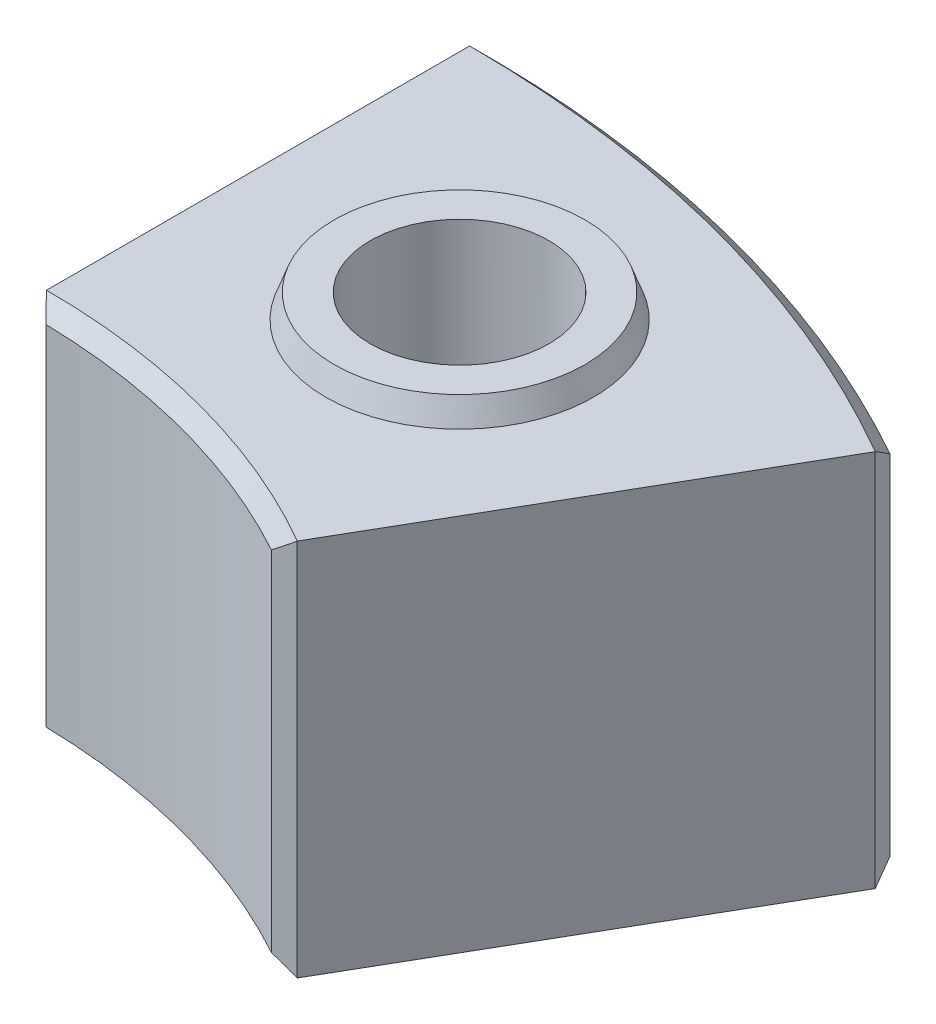
from build123d import *

# Parameters (mm, degrees)
SKETCH1_R           = 30
BOSS_EXTRUDE1_DEPTH = 127
BOSS_EXTRUDE2_START = 8
SKETCH3_R           = 45
SKETCH3_R_2         = 30
BOSS_EXTRUDE2_DEPTH = 8
CHAMFER1_SIZE2      = 8
CHAMFER1_SIZE       = 2.911761874
CUT_EXTRUDE1_START  = -10
SKETCH4_R           = 46
SKETCH4_R_2         = 30
CUT_EXTRUDE1_DEPTH  = 10
CHAMFER2_SIZE2      = 10
CHAMFER2_SIZE       = 3.639702343


# Some blends are built 0.0001 mm under size
with BuildPart() as part:
    # Sketch1 → Boss-Extrude1 (new body)
    with BuildSketch(Plane(origin=(0, 0, 0), x_dir=(1, 0, 0), z_dir=(0, 1, 0))):
        with BuildLine():
            Line((112.5, 194.855715851), (188.5, 326.491577227))
            ThreePointArc((188.5, 326.491577227), (97.574780004, 364.154036511), (0, 377))
            Line((0, 377), (0, 225))
            ThreePointArc((0, 225), (58.234285148, 217.333310915), (112.5, 194.855715851))
        make_face()
        with Locations(Location((77.904532576, 290.743673713, 0), (0, 0, 270))):
            Circle(SKETCH1_R, mode=Mode.SUBTRACT)
    extrude(amount=-BOSS_EXTRUDE1_DEPTH)

    # Sketch3 → Boss-Extrude2 (add)
    with BuildSketch(Plane(origin=(0, 0, 0), x_dir=(1, 0, 0), z_dir=(0, 1, 0)).offset(BOSS_EXTRUDE2_START)):
        with Locations(Location((77.904532576, 290.743673713, 0), (0, 0, 270))):
            Circle(SKETCH3_R)
        with Locations(Location((77.904532576, 290.743673713, 0), (0, 0, 270))):
            Circle(SKETCH3_R_2, mode=Mode.SUBTRACT)
    extrude(amount=-BOSS_EXTRUDE2_DEPTH)

    # Chamfer1
    chamfer1_edges = [part.edges().sort_by_distance(p)[0] for p in [
        (77.904532576, 8, -335.743673713),
    ]]
    chamfer1_side = [part.faces().sort_by_distance(p)[0] for p in [
        (77.904532576, 8, -335.685438476),
    ]]
    chamfer(chamfer1_edges, length=CHAMFER1_SIZE - 0.0001, length2=CHAMFER1_SIZE2 - 0.0001, reference=chamfer1_side[0])  # a hair under: the kernel refuses the full size

    # Sketch4 → Cut-Extrude1 (cut)
    with BuildSketch(Plane.XZ.offset(127).offset(CUT_EXTRUDE1_START)):
        with Locations(Location((77.904532576, -290.743673713, 0), (0, 0, 270))):
            Circle(SKETCH4_R)
        with Locations(Location((77.904532576, -290.743673713, 0), (0, 0, 90))):
            Circle(SKETCH4_R_2, mode=Mode.SUBTRACT)
    extrude(amount=CUT_EXTRUDE1_DEPTH, mode=Mode.SUBTRACT)

    # Chamfer2
    chamfer2_edges = [part.edges().sort_by_distance(p)[0] for p in [
        (77.904532576, -117, -244.743673713),
    ]]
    chamfer2_side = [part.faces().sort_by_distance(p)[0] for p in [
        (77.904532576, -117, -244.81646776),
    ]]
    chamfer(chamfer2_edges, length=CHAMFER2_SIZE - 0.0001, length2=CHAMFER2_SIZE2 - 0.0001, reference=chamfer2_side[0])  # a hair under: the kernel refuses the full size

    # Chamfer3
    # the kernel refuses this chamfer: 5 mm, written as the material it takes off along each edge
    with BuildSketch(Plane(origin=(0, -127, 0), x_dir=(0.5292424705918727, 0, -0.8484706284379036), z_dir=(0.8484706284379036, 0, 0.5292424705918727))) as chamfer3_piece_1:
        with BuildLine():
            Line((371.858578644, -0.141421356), (377.141421356, 5.141421356))
            Line((377.141421356, 5.141421356), (377.241421356, 5.141421356))
            ThreePointArc((377.241421356, 5.141421356), (377.1, 2.570710678), (377.1, 0))
            Line((377.1, 0), (377, -0.1))
            ThreePointArc((377, -0.1), (374.429289322, -0.1), (371.858578644, -0.241421356))
            Line((371.858578644, -0.241421356), (371.858578644, -0.141421356))
        make_face()
    revolve(axis=Axis((0, -127, 0), (0, 1, 0)), revolution_arc=33.908571791, mode=Mode.SUBTRACT)
    with BuildSketch(Plane(origin=(0, -127, 0), x_dir=(-0.05711995451760951, 0, -0.9983673225801746), z_dir=(-0.9983673225801746, 0, 0.05711995451760951))) as chamfer3_piece_2:
        with BuildLine():
            Line((230.141421356, 0.141421356), (224.858578644, -5.141421356))
            Line((224.858578644, -5.141421356), (224.758578644, -5.141421356))
            ThreePointArc((224.758578644, -5.141421356), (224.9, -2.570710678), (224.9, 0))
            Line((224.9, 0), (225, 0.1))
            ThreePointArc((225, 0.1), (227.570710678, 0.1), (230.141421356, 0.241421356))
            Line((230.141421356, 0.241421356), (230.141421356, 0.141421356))
        make_face()
    revolve(axis=Axis((0, -127, 0), (0, -1, 0)), revolution_arc=36.549029178, mode=Mode.SUBTRACT)
    with BuildSketch(Plane(origin=(0, 0, 0), x_dir=(0.5292424705918727, 0, -0.8484706284379036), z_dir=(0.8484706284379036, 0, 0.5292424705918727))) as chamfer3_piece_3:
        with BuildLine():
            Line((377.141421356, -5.141421356), (371.858578644, 0.141421356))
            Line((371.858578644, 0.141421356), (371.858578644, 0.241421356))
            ThreePointArc((371.858578644, 0.241421356), (374.429289322, 0.1), (377, 0.1))
            Line((377, 0.1), (377.1, 0))
            ThreePointArc((377.1, 0), (377.1, -2.570710678), (377.241421356, -5.141421356))
            Line((377.241421356, -5.141421356), (377.141421356, -5.141421356))
        make_face()
    revolve(axis=Axis((0, 0, 0), (0, 1, 0)), revolution_arc=33.908571791, mode=Mode.SUBTRACT)
    with BuildSketch(Plane(origin=(0, 0, 0), x_dir=(-0.05711995451760943, 0, -0.9983673225801746), z_dir=(-0.9983673225801746, 0, 0.05711995451760943))) as chamfer3_piece_4:
        with BuildLine():
            Line((224.858578644, 5.141421356), (230.141421356, -0.141421356))
            Line((230.141421356, -0.141421356), (230.141421356, -0.241421356))
            ThreePointArc((230.141421356, -0.241421356), (227.570710678, -0.1), (225, -0.1))
            Line((225, -0.1), (224.9, 0))
            ThreePointArc((224.9, 0), (224.9, 2.570710678), (224.758578644, 5.141421356))
            Line((224.758578644, 5.141421356), (224.858578644, 5.141421356))
        make_face()
    revolve(axis=Axis((0, 0, 0), (0, -1, 0)), revolution_arc=36.549029178, mode=Mode.SUBTRACT)
    with BuildSketch(Plane(origin=(0, 12.726295315, -225), x_dir=(-0.027477698296736765, 0, -0.9996224167636066), z_dir=(0, -1, 0))) as chamfer3_piece_5:
        with BuildLine():
            Line((5.090518126, 0), (-0.33429411, 5.023891374))
            Line((-0.33429411, 5.023891374), (-0.434172994, 5.018971161))
            ThreePointArc((-0.434172994, 5.018971161), (-0.183141977, 2.511326919), (-0.099962242, -0.00274777))
            Line((-0.099962242, -0.00274777), (0.00274777, -0.099962242))
            ThreePointArc((0.00274777, -0.099962242), (2.546085101, -0.030050788), (5.093265896, -0.099962242))
            Line((5.093265896, -0.099962242), (5.090518126, 0))
        make_face()
    extrude(amount=152.452590629, mode=Mode.SUBTRACT)
    with BuildSketch(Plane(origin=(0, 13.026648977, -377), x_dir=(-0.0275053668618043, 0, 0.9996216558247413), z_dir=(0, -1, 0))) as chamfer3_piece_6:
        with BuildLine():
            Line((5.176029718, 0), (-0.249663351, -5.204674974))
            Line((-0.249663351, -5.204674974), (-0.349653457, -5.203268263))
            ThreePointArc((-0.349653457, -5.203268263), (-0.162620276, -2.601558906), (-0.099962166, 0.002750537))
            Line((-0.099962166, 0.002750537), (0.002750537, 0.099962166))
            ThreePointArc((0.002750537, 0.099962166), (2.588807445, 0.0288048), (5.178780254, 0.099962166))
            Line((5.178780254, 0.099962166), (5.176029718, 0))
        make_face()
    extrude(amount=153.053297954, mode=Mode.SUBTRACT)
    with BuildSketch(Plane(origin=(188.5, 13.026648977, -326.491577227), x_dir=(-0.8556337629027079, 0, -0.5175817459889334), z_dir=(0, -1, 0))) as chamfer3_piece_7:
        with BuildLine():
            Line((5.210659591, 0), (-0.248004097, -5.170084874))
            Line((-0.248004097, -5.170084874), (-0.347983242, -5.168042668))
            ThreePointArc((-0.347983242, -5.168042668), (-0.152811741, -2.584453961), (-0.099979145, 0.002042206))
            Line((-0.099979145, 0.002042206), (0.002042206, 0.099979145))
            ThreePointArc((0.002042206, 0.099979145), (2.60636271, 0.037782504), (5.214045418, 0.099942664))
            Line((5.214045418, 0.099942664), (5.210659591, 0))
        make_face()
    extrude(amount=153.053297954, mode=Mode.SUBTRACT)
    with BuildSketch(Plane(origin=(112.5, 12.726295315, -194.855715851), x_dir=(-0.8848441204167522, 0, -0.46588719939906503), z_dir=(0, -1, 0))) as chamfer3_piece_8:
        with BuildLine():
            Line((5.0350012, 0), (-0.337980103, 5.0792858))
            Line((-0.337980103, 5.0792858), (-0.437904212, 5.075390609))
            ThreePointArc((-0.437904212, 5.075390609), (-0.199029377, 2.538471922), (-0.099924109, -0.003895191))
            Line((-0.099924109, -0.003895191), (0.003895191, -0.099924109))
            ThreePointArc((0.003895191, -0.099924109), (2.517945165, -0.016000711), (5.036723207, -0.099985172))
            Line((5.036723207, -0.099985172), (5.0350012, 0))
        make_face()
    extrude(amount=152.452590629, mode=Mode.SUBTRACT)


solid = part.part
